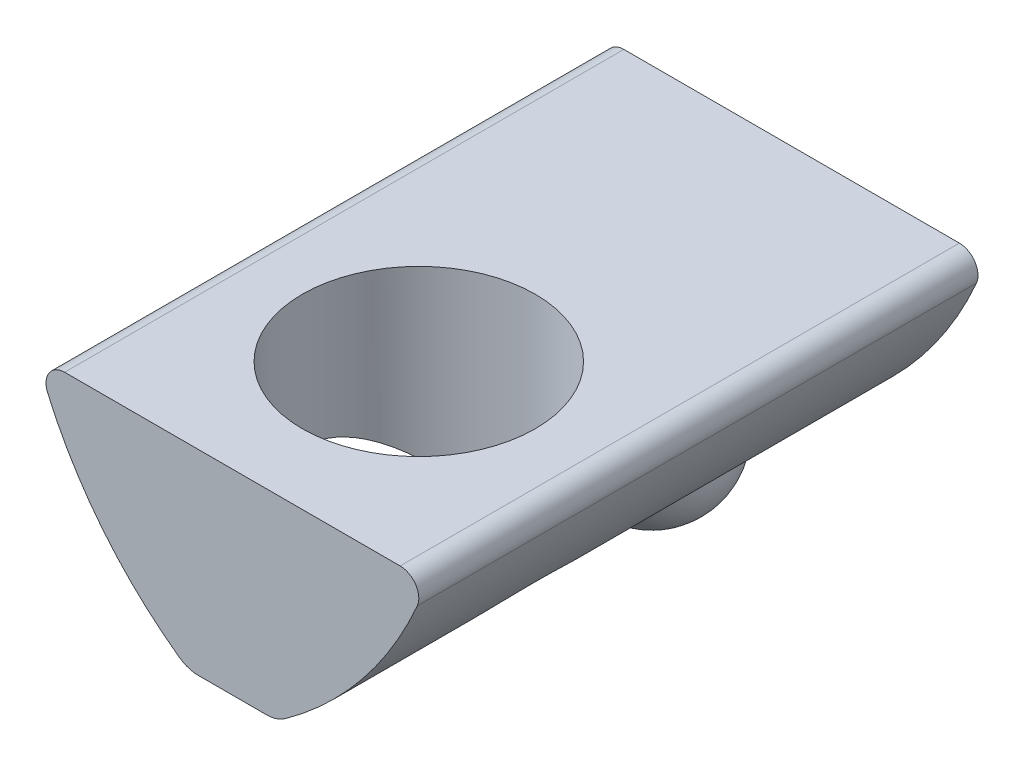
from build123d import *

# Parameters (mm, degrees)
SKETCH1_R              = 2.5
BOSS_EXTRUDE1_DEPTH    = 8
CUT_SWEEP1_PITCH       = 0.7999999999999955
CUT_SWEEP1_HEIGHT      = 8.799999999999976
CUT_SWEEP1_RADIUS      = 2.5000000000000004
CUT_SWEEP1_START_ANGLE = -179.99999999999997
SKETCH4_OUTSIDE_W      = 10.736
SKETCH4_OUTSIDE_H      = 10.736
SKETCH4_OUTSIDE_R      = 1.8937822173508914
CUT_EXTRUDE1_DEPTH     = 0.8
CUT_EXTRUDE1_DRAFT     = -45.0000000000001
CUT_EXTRUDE2_DEPTH     = 1.8
BOSS_EXTRUDE2_START    = 4
BOSS_EXTRUDE2_DEPTH    = 12
SKETCH9_R              = 2.5
CUT_EXTRUDE4_DEPTH     = 13.270391295716696
SKETCH10_W             = 1.5
SKETCH10_H             = 3.9999999999999996


with BuildPart() as part:
    # Sketch1 → Boss-Extrude1 (new body)
    with BuildSketch(Plane(origin=(0, 0, 0), x_dir=(1, 0, 0), z_dir=(0, 1, 0))):
        with Locations(Location((0, 0, 0), (0, 0, 270))):
            Circle(SKETCH1_R)
    extrude(amount=-BOSS_EXTRUDE1_DEPTH)

    # Cut-Sweep1: sweep along a helix
    with BuildLine() as cut_sweep1_path:
        add(Helix(CUT_SWEEP1_PITCH, CUT_SWEEP1_HEIGHT, CUT_SWEEP1_RADIUS, center=(0, -8.000000000000002, 0), direction=(0, 1, 0), mode=Mode.PRIVATE).rotate(Axis((0, -8.000000000000002, 0), (0, 1, 0)), CUT_SWEEP1_START_ANGLE))
    # Sketch3 → Cut-Sweep1 (sweep, cut)
    with BuildSketch(Plane(origin=(0, 0, 0), x_dir=(0, 0, -1), z_dir=(1, 0, 0))):
        Polygon((1.9803847577293245, -8.300000000000004), (2.543301270189217, -7.975000000000005), (2.543301270189217, -8.725000000000001), (1.9803847577293245, -8.400000000000002), align=None)
    sweep(path=cut_sweep1_path.line, is_frenet=True, mode=Mode.SUBTRACT)


with BuildPart() as cut_extrude1_tool:
    # Sketch4 outside → Cut-Extrude1 (with draft: the straight prism first)
    with BuildSketch(Plane.XZ.offset(8)):
        Rectangle(SKETCH4_OUTSIDE_W, SKETCH4_OUTSIDE_H)
        Circle(SKETCH4_OUTSIDE_R, mode=Mode.SUBTRACT)
    extrude(amount=-CUT_EXTRUDE1_DEPTH)
    # Cut-Extrude1: the draft: its side faces are tilted about the plane it starts from
    cut_extrude1_sides = [cut_extrude1_tool.faces().sort_by_distance(p)[0] for p in [
        (0, -7.6, -5.368),
        (5.368, -7.6, 0),
        (0, -7.6, 5.368),
        (-5.368, -7.6, 0),
        (-1.893782217, -7.6, 0),
    ]]
    draft(cut_extrude1_sides, Plane.XZ.offset(8), CUT_EXTRUDE1_DRAFT)


with BuildPart() as part_1:
    add(part.part)

    # Cut-Extrude1: cut by cut_extrude1_tool
    add(cut_extrude1_tool.part, mode=Mode.SUBTRACT)

    # Sketch5 → Revolve1 (revolve)
    with BuildSketch(Plane.XY, mode=Mode.PRIVATE) as revolve1_sk:
        with BuildLine():
            Line((6e-17, 2.8), (0, 0))
            Line((0, 0), (-4.75, -5.6e-16))
            Line((-4.75, -5.6e-16), (-4.75, 0.6999999999999993))
            ThreePointArc((-4.75, 0.6999999999999993), (-3.774006491780319, 1.9096498126217711), (-2.5, 2.7999999999999994))
            Line((-2.5, 2.7999999999999994), (6e-17, 2.8))
        make_face()
    revolve(revolve1_sk.sketch.rotate(Axis((0, 0, 0), (1.2e-16, -1, 0)), 90), axis=Axis((0, 0, 0), (1.2e-16, -1, 0)))

    # Sketch6 → Cut-Extrude2 (cut)
    with BuildSketch(Plane(origin=(-3.5e-16, 2.8000000000000003, 0), x_dir=(1, 1.2e-16, 0), z_dir=(-1.2e-16, 1, 0))):
        Polygon((0, 1.7320508075688774), (-1.5000000000000004, 0.8660254037844389), (-1.5000000000000002, -0.866025403784439), (3e-17, -1.7320508075688779), (1.5, -0.8660254037844396), (1.4999999999999998, 0.8660254037844392), align=None)
    extrude(amount=-CUT_EXTRUDE2_DEPTH, mode=Mode.SUBTRACT)

    # Cut-Extrude3 cone 1 section (through the dimple's axis) → Cut-Extrude3 (revolve, cut)
    with BuildSketch(Plane(origin=(0, 2.8, 0), x_dir=(0, 0, 1), z_dir=(1, 0, 0))):
        Polygon((0, 0), (1.732050808, 0), (0, 1.732050808), align=None)
    revolve(axis=Axis((0, 2.8, 0), (0, -1, 0)), mode=Mode.SUBTRACT)


with BuildPart() as body_2:
    # Sketch8 → Boss-Extrude2 (new body)
    with BuildSketch(Plane.XY.offset(BOSS_EXTRUDE2_START)):
        with BuildLine():
            Line((-0.729539694732655, -6.200000000000001), (0.7295396947326566, -6.200000000000001))
            ThreePointArc((0.7295396947326566, -6.200000000000001), (0.9444293615952137, -6.166199993302087), (1.1385668222312952, -6.068064088787715))
            ThreePointArc((1.1385668222312952, -6.068064088787715), (2.7894535956378506, -4.5046324857998545), (3.9668242545450783, -2.559499110585124))
            ThreePointArc((3.9668242545450783, -2.559499110585124), (3.934514307791197, -2.180682472467487), (3.6, -1.9999999999999996))
            Line((3.6, -1.9999999999999996), (-3.599999999999999, -2.0000000000000004))
            ThreePointArc((-3.599999999999999, -2.0000000000000004), (-3.934514307791197, -2.1806824724674874), (-3.9668242545450783, -2.559499110585125))
            ThreePointArc((-3.9668242545450783, -2.559499110585125), (-2.789453595637847, -4.504632485799857), (-1.1385668222312935, -6.068064088787715))
            ThreePointArc((-1.1385668222312935, -6.068064088787715), (-0.9444293615952122, -6.166199993302087), (-0.729539694732655, -6.200000000000001))
        make_face()
    extrude(amount=-BOSS_EXTRUDE2_DEPTH)

    # Sketch9 → Cut-Extrude4 (cut, through all)
    with BuildSketch(Plane(origin=(0, 0, 0), x_dir=(1, 0, 0), z_dir=(0, 1, 0))):
        with Locations(Location((0, 0, 0), (0, 0, 253.033298699))):
            Circle(SKETCH9_R)
    extrude(amount=-CUT_EXTRUDE4_DEPTH, mode=Mode.SUBTRACT)

    # Sketch10 → Cut-Revolve1 (revolve, cut)
    with BuildSketch(Plane(origin=(0, 0, 0), x_dir=(0, 0, -1), z_dir=(1, 0, 0))):
        with Locations((5.750000000000001, -4.2)):
            Rectangle(SKETCH10_W, SKETCH10_H)
    revolve(axis=Axis((0, -2.2000000000000006, -5.000000000000001), (0, 1, 0)), mode=Mode.SUBTRACT)


with BuildPart() as body_3:
    # Sketch11 → Revolve2 (revolve)
    with BuildSketch(Plane(origin=(0, 0, 0), x_dir=(0, 0, -1), z_dir=(1, 0, 0))):
        with BuildLine():
            Line((5.000000000000001, -4.300000000000002), (5.000000000000001, -7.300000000000001))
            ThreePointArc((5.000000000000001, -7.300000000000001), (6.500000000000001, -5.800000000000001), (5.000000000000001, -4.300000000000002))
        make_face()
    revolve(axis=Axis((0, -4.300000000000002, -5.000000000000001), (0, -1, 0)))


solid = Compound([body_2.part, body_3.part])
